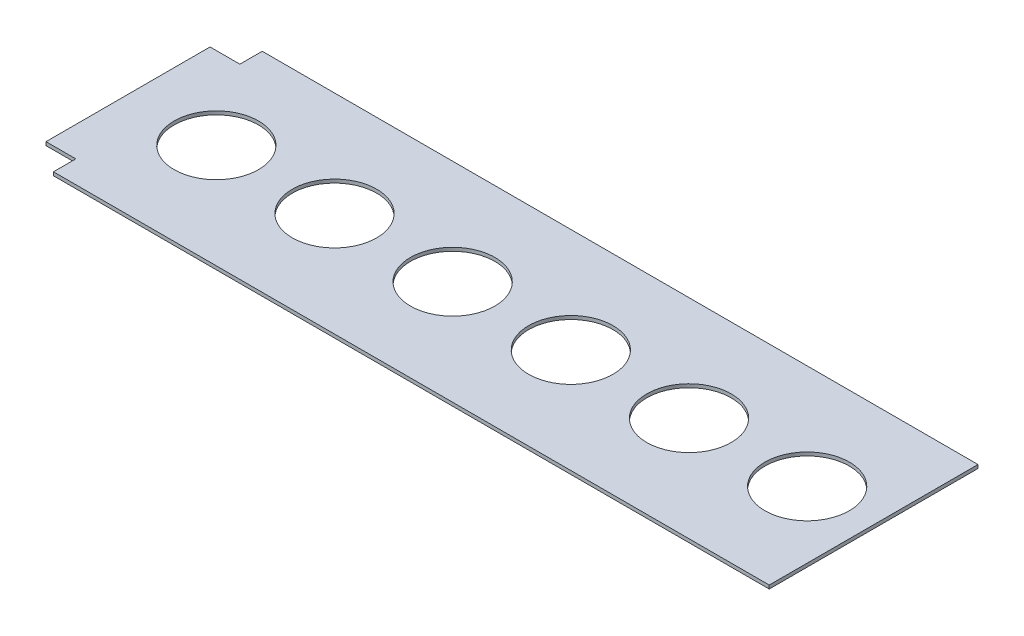
from build123d import *

# Parameters (mm, degrees)
SKETCH1_R           = 35.935
BOSS_EXTRUDE1_DEPTH = 2.9718


with BuildPart() as part:
    # Sketch1 → Boss-Extrude1 (new body)
    with BuildSketch(Plane(origin=(0, 0, 0), x_dir=(1, 0, 0), z_dir=(0, 1, 0))):
        Polygon((720.939652548, 80.344563306), (720.939652548, -59.355436694), (746.339652548, -59.355436694), (746.339652548, -78.405436694), (1355.939652548, -78.405436694), (1355.939652548, 99.394563306), (746.339652548, 99.394563306), (746.339652548, 80.344563306), align=None)
        with Locations((1299.335652548, 10.494563306)):
            Circle(SKETCH1_R, mode=Mode.SUBTRACT)
        with Locations((1198.700852548, 10.494563306)):
            Circle(SKETCH1_R, mode=Mode.SUBTRACT)
        with Locations((1098.066052548, 10.494563306)):
            Circle(SKETCH1_R, mode=Mode.SUBTRACT)
        with Locations((997.431252548, 10.494563306)):
            Circle(SKETCH1_R, mode=Mode.SUBTRACT)
        with Locations((896.796452548, 10.494563306)):
            Circle(SKETCH1_R, mode=Mode.SUBTRACT)
        with Locations((796.161652548, 10.494563306)):
            Circle(SKETCH1_R, mode=Mode.SUBTRACT)
    extrude(amount=BOSS_EXTRUDE1_DEPTH)


solid = part.part
